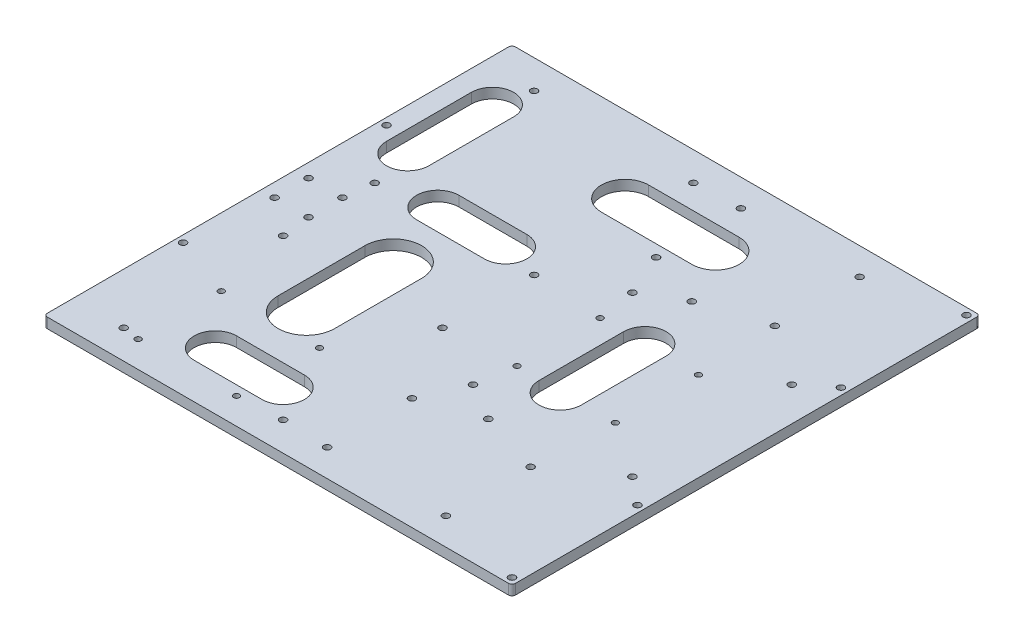
from build123d import *

# Parameters (mm, degrees)
SKETCH_1_W              = 276
SKETCH_1_H              = 276
EXTRUDE_1_DEPTH         = 6
FILLET_1_R              = 2
SKETCH_2_R              = 2
CUT_EXTRUDE_1_DEPTH     = 6
SKETCH_10_R             = 2
CUT_EXTRUDE_1975_DEPTH  = 7
SKETCH_4_R              = 2
CUT_EXTRUDE_94_94_DEPTH = 6
SKETCH_8_R              = 1.75
RPI4_DEPTH              = 6
CUT_EXTRUDE_5_DEPTH     = 6


with BuildPart() as part:
    # Эскиз1 → Бобышка-Вытянуть1 (new body)
    with BuildSketch(Plane(origin=(0, 0, 0), x_dir=(1, 0, 0), z_dir=(0, 1, 0))):
        Rectangle(SKETCH_1_W, SKETCH_1_H)
    extrude(amount=EXTRUDE_1_DEPTH)

    # Скругление1
    fillet_1_edges = [part.edges().sort_by_distance(p)[0] for p in [
        (138, 3, 138),
        (-138, 3, 138),
        (-138, 3, -138),
        (138, 3, -138),
    ]]
    fillet(fillet_1_edges, radius=FILLET_1_R)

    # Эскиз2 → Вырез-Вытянуть1 (cut)
    with BuildSketch(Plane(origin=(0, 6, 0), x_dir=(1, 0, 0), z_dir=(0, 1, 0))):
        with Locations((-134, 60)):
            Circle(SKETCH_2_R)
        with Locations((134, 60)):
            Circle(SKETCH_2_R)
        with Locations((134, -60)):
            Circle(SKETCH_2_R)
        with Locations((-134, -60)):
            Circle(SKETCH_2_R)
        with Locations((46, 60)):
            Circle(SKETCH_2_R)
        with Locations((46, -60)):
            Circle(SKETCH_2_R)
        with Locations((134, 134)):
            Circle(SKETCH_2_R)
        with Locations((134, -134)):
            Circle(SKETCH_2_R)
    extrude(amount=-CUT_EXTRUDE_1_DEPTH, mode=Mode.SUBTRACT)

    # Эскиз10 → Cut-Extrude 1975 (cut)
    with BuildSketch(Plane(origin=(0, 6, 0), x_dir=(1, 0, 0), z_dir=(0, 1, 0))):
        with Locations((13, 122)):
            Circle(SKETCH_10_R)
        with Locations((83, 122)):
            Circle(SKETCH_10_R)
        with Locations((13, 72)):
            Circle(SKETCH_10_R)
        with Locations((83, 72)):
            Circle(SKETCH_10_R)
        with Locations((-130, 10)):
            Circle(SKETCH_10_R)
        with Locations((-110, 10)):
            Circle(SKETCH_10_R)
        with Locations((-110, -10)):
            Circle(SKETCH_10_R)
        with Locations((-130, -10)):
            Circle(SKETCH_10_R)
        with Locations((83, -72)):
            Circle(SKETCH_10_R)
        with Locations((13, -72)):
            Circle(SKETCH_10_R)
        with Locations((83, -122)):
            Circle(SKETCH_10_R)
        with Locations((13, -122)):
            Circle(SKETCH_10_R)
    extrude(amount=-CUT_EXTRUDE_1975_DEPTH, mode=Mode.SUBTRACT)

    # Эскиз4 → 94х94 (cut)
    with BuildSketch(Plane(origin=(0, 6, 0), x_dir=(1, 0, 0), z_dir=(0, 1, 0))):
        with Locations((-108, 121)):
            Circle(SKETCH_4_R)
        with Locations((-14, 121)):
            Circle(SKETCH_4_R)
        with Locations((-14, 27)):
            Circle(SKETCH_4_R)
        with Locations((-108, 27)):
            Circle(SKETCH_4_R)
        with Locations((-108, -27)):
            Circle(SKETCH_4_R)
        with Locations((-14, -27)):
            Circle(SKETCH_4_R)
        with Locations((-14, -121)):
            Circle(SKETCH_4_R)
        with Locations((-108, -121)):
            Circle(SKETCH_4_R)
        with Locations((24, 47)):
            Circle(SKETCH_4_R)
        with Locations((118, 47)):
            Circle(SKETCH_4_R)
        with Locations((118, -47)):
            Circle(SKETCH_4_R)
        with Locations((24, -47)):
            Circle(SKETCH_4_R)
    extrude(amount=-CUT_EXTRUDE_94_94_DEPTH, mode=Mode.SUBTRACT)

    # Эскиз8 → RPi4 (cut)
    with BuildSketch(Plane(origin=(0, 6, 0), x_dir=(1, 0, 0), z_dir=(0, 1, 0))):
        with Locations((85.46549702, 24.5)):
            Circle(SKETCH_8_R)
        with Locations((27.46549702, 24.5)):
            Circle(SKETCH_8_R)
        with Locations((27.46549702, -24.5)):
            Circle(SKETCH_8_R)
        with Locations((85.46549702, -24.5)):
            Circle(SKETCH_8_R)
        with Locations((-40, -73.5)):
            Circle(SKETCH_8_R)
        with Locations((-98, -73.5)):
            Circle(SKETCH_8_R)
        with Locations((-98, -122.5)):
            Circle(SKETCH_8_R)
        with Locations((-40, -122.5)):
            Circle(SKETCH_8_R)
    extrude(amount=-RPI4_DEPTH, mode=Mode.SUBTRACT)

    # Эскиз6 → Вырез-Вытянуть5 (cut)
    with BuildSketch(Plane(origin=(0, 6, 0), x_dir=(1, 0, 0), z_dir=(0, 1, 0))):
        with BuildLine():
            Line((-30.62792666, -91.796358409), (-70.62792666, -91.796358409))
            ThreePointArc((-70.62792666, -91.796358409), (-83.12792666, -104.296358409), (-70.62792666, -116.796358409))
            Line((-70.62792666, -116.796358409), (-30.62792666, -116.796358409))
            ThreePointArc((-30.62792666, -116.796358409), (-18.12792666, -104.296358409), (-30.62792666, -91.796358409))
        make_face()
        with BuildLine():
            Line((-36.854148501, 45.577500198), (-76.854148501, 45.577500198))
            ThreePointArc((-76.854148501, 45.577500198), (-89.354148501, 33.077500198), (-76.854148501, 20.577500198))
            Line((-76.854148501, 20.577500198), (-36.854148501, 20.577500198))
            ThreePointArc((-36.854148501, 20.577500198), (-24.354148501, 33.077500198), (-36.854148501, 45.577500198))
        make_face()
        with BuildLine():
            ThreePointArc((-100.792186218, 101.779020019), (-113.292186218, 114.279020019), (-125.792186218, 101.779020019))
            Line((-125.792186218, 101.779020019), (-125.792186218, 51.779020019))
            ThreePointArc((-125.792186218, 51.779020019), (-113.292186218, 39.279020019), (-100.792186218, 51.779020019))
            Line((-100.792186218, 51.779020019), (-100.792186218, 101.779020019))
        make_face()
        with BuildLine():
            Line((27.18238493, 106.773909834), (-26.207579038, 106.773909834))
            ThreePointArc((-26.207579038, 106.773909834), (-40.115888979, 92.865599892), (-26.207579038, 78.957289951))
            Line((-26.207579038, 78.957289951), (27.18238493, 78.957289951))
            ThreePointArc((27.18238493, 78.957289951), (41.090694872, 92.865599892), (27.18238493, 106.773909834))
        make_face()
        with BuildLine():
            ThreePointArc((-45.432108508, -7.888425697), (-62.147948764, 8.827414559), (-78.86378902, -7.888425697))
            Line((-78.86378902, -7.888425697), (-78.86378902, -59.108123383))
            ThreePointArc((-78.86378902, -59.108123383), (-62.147948764, -75.823963639), (-45.432108508, -59.108123383))
            Line((-45.432108508, -59.108123383), (-45.432108508, -7.888425697))
        make_face()
        with BuildLine():
            ThreePointArc((66.348697743, 24.533398762), (53.848697743, 37.033398762), (41.348697743, 24.533398762))
            Line((41.348697743, 24.533398762), (41.348697743, -25.466601238))
            ThreePointArc((41.348697743, -25.466601238), (53.848697743, -37.966601238), (66.348697743, -25.466601238))
            Line((66.348697743, -25.466601238), (66.348697743, 24.533398762))
        make_face()
    extrude(amount=-CUT_EXTRUDE_5_DEPTH, mode=Mode.SUBTRACT)


solid = part.part
